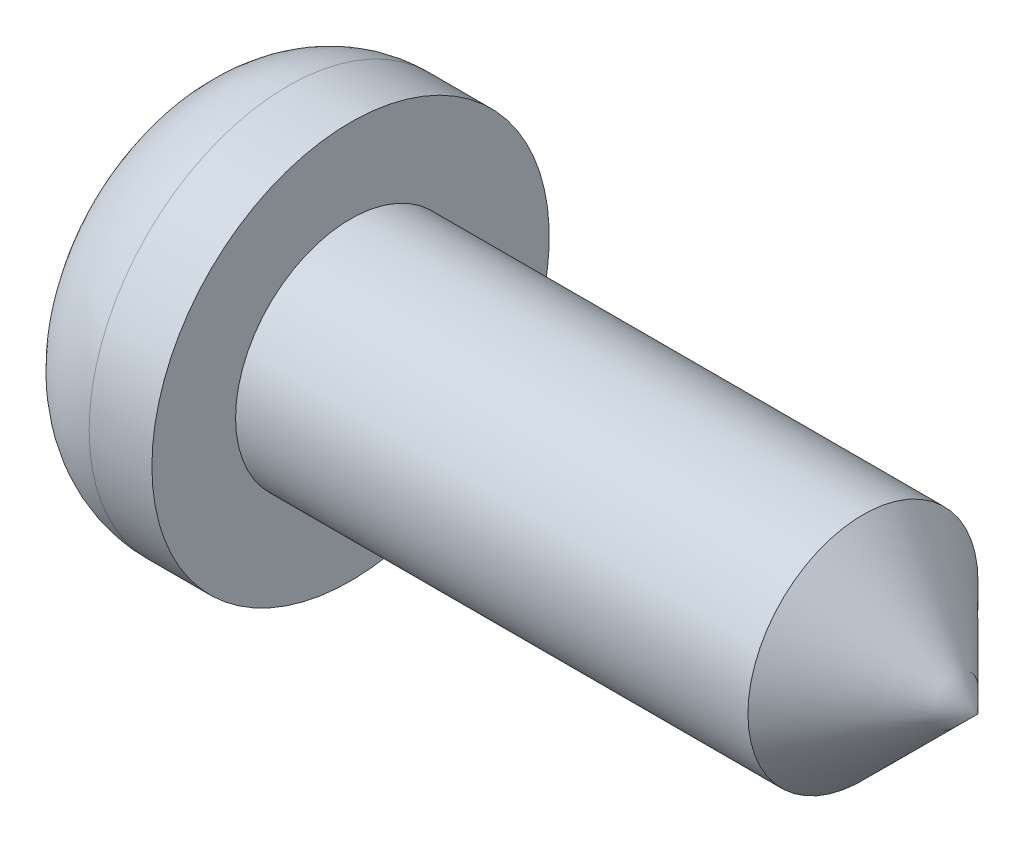
from build123d import *

# Parameters (mm, degrees)
CUT_EXTRUDE_1_DEPTH = 0.5
FILLET_1_R          = 1


with BuildPart() as part:
    # 草图1 → 旋转1 (revolve)
    with BuildSketch(Plane.XY, mode=Mode.PRIVATE) as revolve_1_sk:
        Polygon((0, 0), (0, 1.9), (1.6, 1.9), (1.6, 1.1), (6.5, 1.1), (7.6, 0), align=None)
    revolve(revolve_1_sk.sketch.rotate(Axis((-6.976540153, 0, 0), (1, 0, 0)), 90), axis=Axis((-6.976540153, 0, 0), (1, 0, 0)))

    # 草图2 → 切除-拉伸1 (cut)
    with BuildSketch(Plane.ZY):
        Polygon((-0.3, 0.3), (-1, 0.3), (-1, -0.3), (-0.3, -0.3), (-0.3, -1), (0.3, -1), (0.3, -0.3), (1, -0.3), (1, 0.3), (0.3, 0.3), (0.3, 1), (-0.3, 1), align=None)
    extrude(amount=-CUT_EXTRUDE_1_DEPTH, mode=Mode.SUBTRACT)

    # 圆角1
    # the kernel refuses this fillet: 1 mm, written as the material it takes off along each edge
    with BuildSketch(Plane(origin=(0, 0, 0), x_dir=(0, 0, 1), z_dir=(0, 1, 0))) as fillet_1_piece_1:
        with BuildLine():
            CenterArc((1.9 - FILLET_1_R, FILLET_1_R), FILLET_1_R, 270, 90)
            Line((1.9, FILLET_1_R), (1.9, 0))
            Line((1.9, 0), (1.9 - FILLET_1_R, 0))
        make_face()
    revolve(axis=Axis((0, 0, 0), (1, 0, 0)), mode=Mode.SUBTRACT)


solid = part.part
